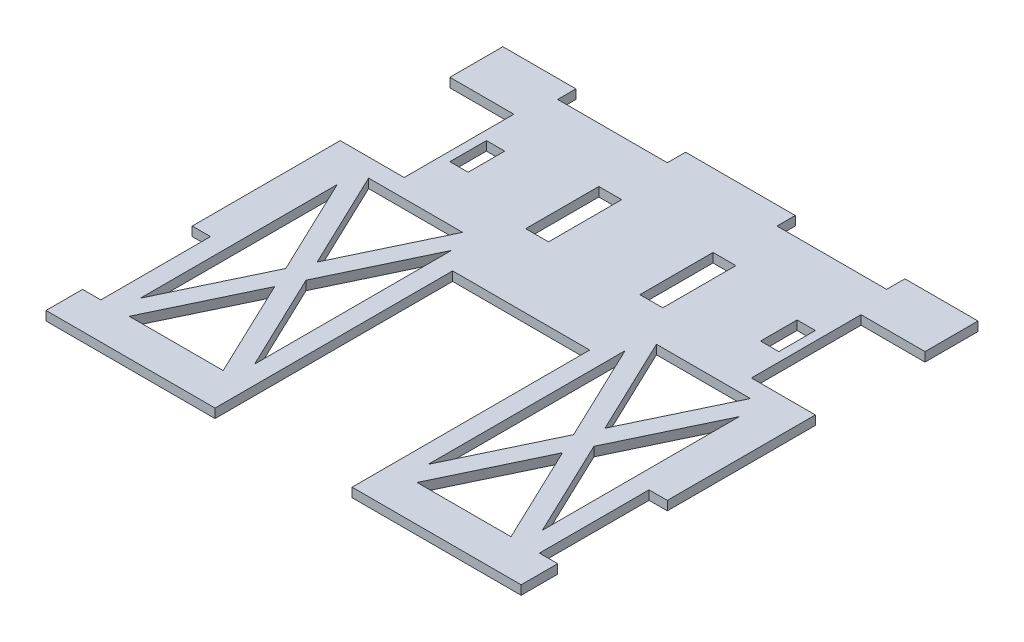
from build123d import *

# Parameters (mm, degrees)
BOSS_EXTRUDE1_DEPTH = 6.35
SKETCH2_W           = 44.45
SKETCH2_H           = 76.2
SKETCH2_W_2         = 12.7
SKETCH2_W_3         = 76.2
SKETCH2_H_2         = 12.7
CUT_EXTRUDE1_DEPTH  = 293.444905068
SKETCH3_W           = 15.875
SKETCH3_H           = 50.8
SKETCH3_W_2         = 12.7
SKETCH3_H_2         = 25.4
CUT_EXTRUDE2_DEPTH  = 293.444905068
CUT_EXTRUDE3_DEPTH  = 293.444905068


with BuildPart() as part:
    # Sketch1 → Boss-Extrude1 (new body)
    with BuildSketch(Plane(origin=(0, 0, 0), x_dir=(1, 0, 0), z_dir=(0, 1, 0))):
        Polygon((-165.1, 76.2), (-165.1, -241.3), (-47.625, -241.3), (-47.625, -76.2), (47.625, -76.2), (47.625, -241.3), (165.1, -241.3), (165.1, 76.2), align=None)
    extrude(amount=BOSS_EXTRUDE1_DEPTH)

    # Sketch2 → Cut-Extrude1 (cut, through all)
    with BuildSketch(Plane(origin=(0, 6.35, 0), x_dir=(1, 0, 0), z_dir=(0, 1, 0))):
        with Locations((142.875, 1.27)):
            Rectangle(SKETCH2_W, SKETCH2_H)
        with Locations((158.75, -177.8)):
            Rectangle(SKETCH2_W_2, SKETCH2_H)
        with Locations((-158.75, -177.8)):
            Rectangle(SKETCH2_W_2, SKETCH2_H)
        with Locations((-142.875, 1.27)):
            Rectangle(SKETCH2_W, SKETCH2_H)
        with Locations((-76.2, 69.85)):
            Rectangle(SKETCH2_W_3, SKETCH2_H_2)
        with Locations((76.2, 69.85)):
            Rectangle(SKETCH2_W_3, SKETCH2_H_2)
    extrude(amount=-CUT_EXTRUDE1_DEPTH, mode=Mode.SUBTRACT)

    # Sketch3 → Cut-Extrude2 (cut, through all)
    with BuildSketch(Plane(origin=(0, 6.35, 0), x_dir=(1, 0, 0), z_dir=(0, 1, 0))):
        with Locations((-39.6875, 0)):
            Rectangle(SKETCH3_W, SKETCH3_H)
        with Locations((39.6875, 0)):
            Rectangle(SKETCH3_W, SKETCH3_H)
        with Locations((107.95, 1.27)):
            Rectangle(SKETCH3_W_2, SKETCH3_H_2)
        with Locations((-107.95, 1.27)):
            Rectangle(SKETCH3_W_2, SKETCH3_H_2)
    extrude(amount=-CUT_EXTRUDE2_DEPTH, mode=Mode.SUBTRACT)

    # Sketch4 → Cut-Extrude3 (cut, through all)
    with BuildSketch(Plane(origin=(0, 6.35, 0), x_dir=(1, 0, 0), z_dir=(0, 1, 0))):
        Polygon((100.0125, -147.46179464), (67.360684466, -215.9), (132.664315534, -215.9), align=None)
        Polygon((60.325, -64.27679464), (60.325, -201.15320536), (92.976815534, -132.715), align=None)
        Polygon((139.7, -64.27679464), (107.048184466, -132.715), (139.7, -201.15320536), align=None)
        Polygon((67.360684466, -49.53), (100.0125, -117.96820536), (132.664315534, -49.53), align=None)
        Polygon((-92.976815534, -132.715), (-60.325, -201.15320536), (-60.325, -64.27679464), align=None)
        Polygon((-132.664315534, -49.53), (-100.0125, -117.96820536), (-67.360684466, -49.53), align=None)
        Polygon((-67.360684466, -215.9), (-100.0125, -147.46179464), (-132.664315534, -215.9), align=None)
        Polygon((-139.7, -201.15320536), (-107.048184466, -132.715), (-139.7, -64.27679464), align=None)
    extrude(amount=-CUT_EXTRUDE3_DEPTH, mode=Mode.SUBTRACT)


solid = part.part
